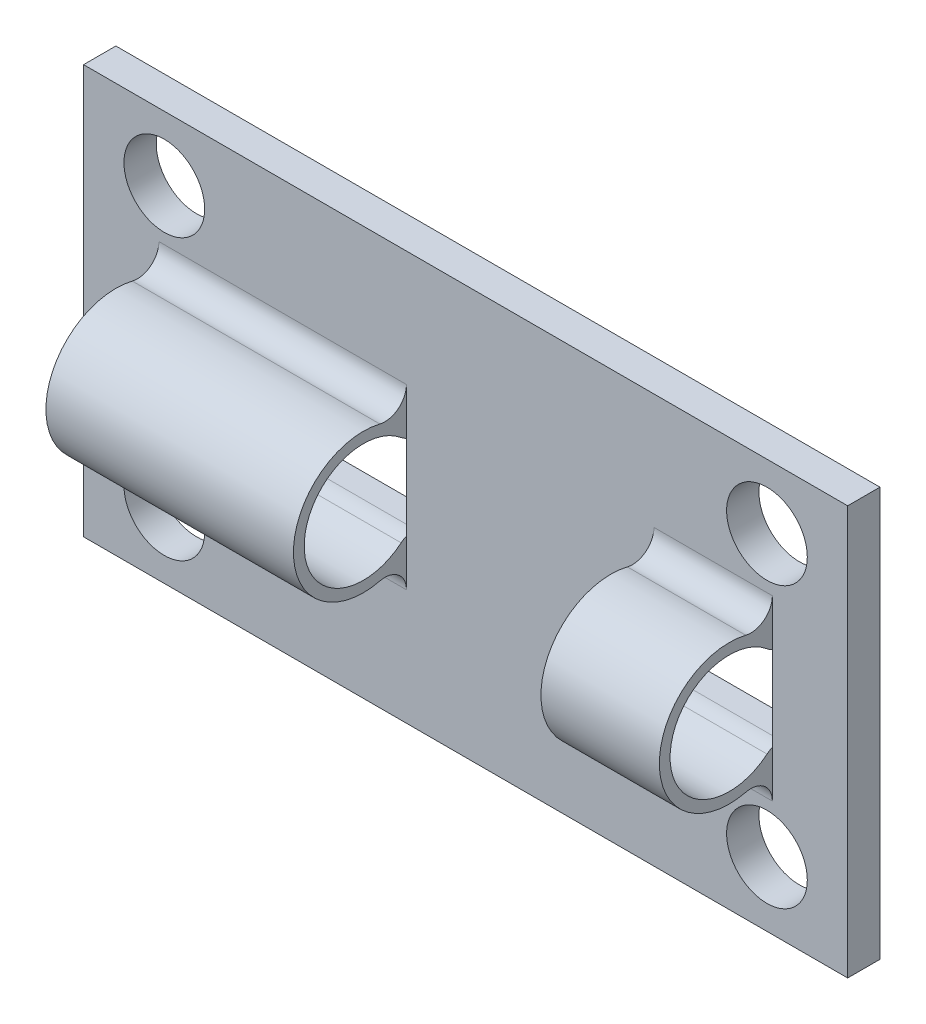
from build123d import *

# Parameters (mm, degrees)
SKETCH1_W           = 71
SKETCH1_H           = 38
SKETCH1_R           = 3.7499999999999996
SKETCH1_R_2         = 3.750000000000006
BOSS_EXTRUDE1_DEPTH = 3
SKETCH3_R           = 6.500000000000002
SKETCH3_R_2         = 5.5
BOSS_EXTRUDE2_DEPTH = 18
BOSS_EXTRUDE3_START = -30
SKETCH4_R           = 6.500000000000001
SKETCH4_R_2         = 5.499999999999999
BOSS_EXTRUDE3_DEPTH = 30
SKETCH5_W           = 11
SKETCH5_H           = 7.54983443527075
CUT_EXTRUDE2_DEPTH  = 30
CUT_EXTRUDE3_START  = -7
CUT_EXTRUDE3_DEPTH  = 7
CUT_EXTRUDE4_DEPTH  = 7
FILLET2_R           = 2
FILLET3_R           = 2


with BuildPart() as part:
    # Sketch1 → Boss-Extrude1 (new body)
    with BuildSketch(Plane.XY):
        Rectangle(SKETCH1_W, SKETCH1_H)
        with Locations((-27.999999999999996, 13.000000000000004)):
            Circle(SKETCH1_R, mode=Mode.SUBTRACT)
        with Locations((27.999999999999996, 13)):
            Circle(SKETCH1_R, mode=Mode.SUBTRACT)
        with Locations((-27.999999999999996, -12.999999999999996)):
            Circle(SKETCH1_R, mode=Mode.SUBTRACT)
        with Locations((27.999999999999996, -12.999999999999996)):
            Circle(SKETCH1_R_2, mode=Mode.SUBTRACT)
    extrude(amount=BOSS_EXTRUDE1_DEPTH)

    # Sketch3 → Boss-Extrude2 (add)
    with BuildSketch(Plane(origin=(35.5, 0, 0), x_dir=(0, 0, -1), z_dir=(1, 0, 0))):
        with Locations((-7, 3.47e-15)):
            Circle(SKETCH3_R)
        with Locations((-7, 3.47e-15)):
            Circle(SKETCH3_R_2, mode=Mode.SUBTRACT)
    extrude(amount=-BOSS_EXTRUDE2_DEPTH)

    # Sketch4 → Boss-Extrude3 (add)
    with BuildSketch(Plane.ZY.offset(35.5).offset(BOSS_EXTRUDE3_START)):
        with Locations((7, 3.47e-15)):
            Circle(SKETCH4_R)
        with Locations((7, 3.47e-15)):
            Circle(SKETCH4_R_2, mode=Mode.SUBTRACT)
    extrude(amount=BOSS_EXTRUDE3_DEPTH)

    # Sketch5 → Cut-Extrude2 (cut)
    with BuildSketch(Plane.XY.offset(3)):
        Polygon((-5.499999999999998, 3.7749172176353767), (-28.499999999999996, 3.7749172176353745), (-28.499999999999996, -3.77491721763537), (-5.499999999999998, -3.77491721763537), align=None)
        with Locations((22.999999999999996, 3.33e-15)):
            Rectangle(SKETCH5_W, SKETCH5_H)
    extrude(amount=-CUT_EXTRUDE2_DEPTH, mode=Mode.SUBTRACT)

    # Sketch6 → Cut-Extrude3 (cut)
    with BuildSketch(Plane.ZY.offset(35.5).offset(CUT_EXTRUDE3_START)):
        with BuildLine():
            Line((3, 3.7749172176353767), (3, 5.123475382979803))
            ThreePointArc((3, 5.123475382979803), (13.5, 6.36e-15), (3, -5.123475382979797))
            Line((3, -5.123475382979797), (3, -3.77491721763537))
            ThreePointArc((3, -3.77491721763537), (12.5, 3.47e-15), (3, 3.7749172176353767))
        make_face()
    extrude(amount=CUT_EXTRUDE3_DEPTH, mode=Mode.SUBTRACT)

    # Sketch7 → Cut-Extrude4 (cut)
    with BuildSketch(Plane(origin=(35.5, 0, 0), x_dir=(0, 0, -1), z_dir=(1, 0, 0))):
        with BuildLine():
            Line((-3, 5.123475382979803), (-3, 3.774917217635378))
            ThreePointArc((-3, 3.774917217635378), (-12.5, 4.14e-15), (-3, -3.774917217635371))
            Line((-3, -3.774917217635371), (-3, -5.123475382979797))
            ThreePointArc((-3, -5.123475382979797), (-13.5, 4.27e-15), (-3, 5.123475382979803))
        make_face()
    extrude(amount=-CUT_EXTRUDE4_DEPTH, mode=Mode.SUBTRACT)

    # Fillet2
    fillet2_edges = [part.edges().sort_by_distance(p)[0] for p in [
        (-17, 5.123475382979804, 3),
        (23, -5.123475382979798, 3),
        (23, 5.123475382979805, 3),
        (-17, -5.123475382979797, 3),
    ]]
    fillet(fillet2_edges, radius=FILLET2_R)

    # Fillet3
    # the kernel refuses this fillet: 2 mm, written as the material it takes off along each edge
    with BuildSketch(Plane(origin=(17.5, 3.7749172176353785, 3), x_dir=(0, 0, -1), z_dir=(1, 0, 0))) as fillet3_piece_1:
        with BuildLine():
            CenterArc((0.7854290434049434, 2), FILLET3_R, 230.35289769223547, 39.6471023077645)
            ThreePointArc((-0.49068536816965125, 0.460022075297303), (-0.2383040211369254, 0.23751887065380473), (0, 0))
            Line((0, 0), (0.7854290434049434, 0))
        make_face()
    extrude(amount=10.999999999999996, mode=Mode.SUBTRACT)
    with BuildSketch(Plane(origin=(-28.499999999999996, -3.77491721763537, 3), x_dir=(0, 5.7e-16, -1), z_dir=(1, 0, 0))) as fillet3_piece_2:
        with BuildLine():
            CenterArc((0.7854290434049418, -2), FILLET3_R, 89.99999999999997, 39.64710230776453)
            ThreePointArc((-0.49068536816965286, -0.46002207529730227), (-0.23830402113692464, -0.23751887065380414), (0, 0))
            Line((0, 0), (0.7854290434049429, 0))
        make_face()
    extrude(amount=22.999999999999996, mode=Mode.SUBTRACT)
    with BuildSketch(Plane(origin=(17.5, -3.7749172176353714, 3), x_dir=(0, -0.6839447234296507, 0.7295338342343956), z_dir=(1, 0, 0))) as fillet3_piece_3:
        with BuildLine():
            CenterArc((0.7948923853050224, 1.9962577183336636), FILLET3_R, 226.84732795972278, 39.647102307770695)
            Line((-0.572997061554437, 0.5371900498650203), (0, 0))
            ThreePointArc((0, 0), (0.33630062455212534, 0.01029127458242615), (0.6726012491042509, 1e-17))
        make_face()
    extrude(amount=10.999999999999996, mode=Mode.SUBTRACT)
    with BuildSketch(Plane(origin=(-28.499999999999996, 3.774917217635377, 3), x_dir=(0, 0.6839447234296516, 0.7295338342343948), z_dir=(1, 0, 0))) as fillet3_piece_4:
        with BuildLine():
            CenterArc((0.7948923853050189, -1.9962577183336638), FILLET3_R, 93.50556973250654, 39.647102307770794)
            Line((-0.5729970615544441, -0.5371900498650239), (0, 0))
            ThreePointArc((0, 0), (0.3363006245521229, -0.01029127458242505), (0.6726012491042468, -6e-17))
        make_face()
    extrude(amount=22.999999999999996, mode=Mode.SUBTRACT)


solid = part.part
